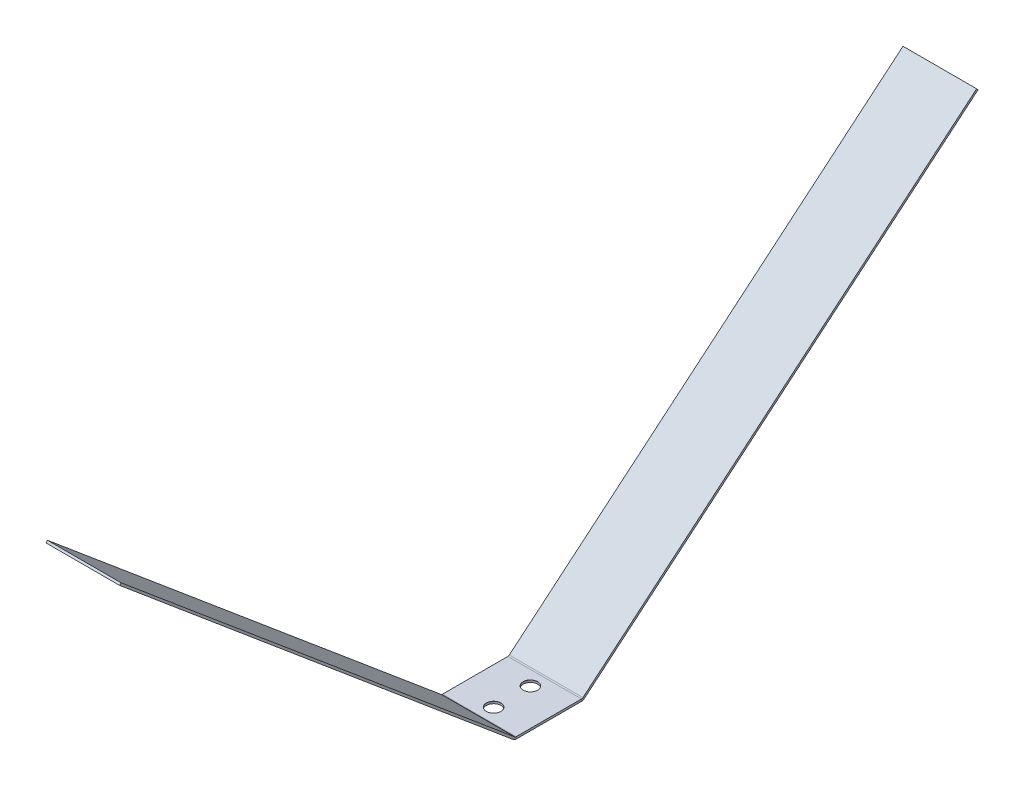
from build123d import *

# Parameters (mm, degrees)
SKETCH5_W                       = 25.4
SKETCH5_H                       = 25.4
BASE_FLANGE1_DEPTH              = 0.7366
EDGE_FLANGE1_START              = 787.4
EDGE_FLANGE1_DEPTH              = 25.4
EDGE_FLANGE1_2_DEPTH            = 25.4
F_5_0MM_DOWEL_HOLE1_D           = 5
F_5_0MM_DOWEL_HOLE1_DEPTH       = 25.4
F_5_0MM_DOWEL_HOLE1_CSINK_D     = 5.05
F_5_0MM_DOWEL_HOLE1_CSINK_ANGLE = 90
F_5_0MM_DOWEL_HOLE1_TIP         = 1.502151548


# Read off the part's stored shape, not the designer's step: Edge-Flange1
# Sheet-metal steps are written as plain solids
with BuildPart() as part:
    # Sketch5 → Base-Flange1 (new body)
    with BuildSketch(Plane(origin=(0, 0, 0), x_dir=(1, 0, 0), z_dir=(0, 1, 0))):
        with Locations((800.1, 101.6)):
            Rectangle(SKETCH5_W, SKETCH5_H)
    extrude(amount=-BASE_FLANGE1_DEPTH)

    # Edge-Flange1 outline → Edge-Flange1 (cut)
    with BuildSketch(Plane.YZ.offset(EDGE_FLANGE1_START)):
        with BuildLine():
            Line((0, -114.3), (-0.391936674, -113.832908061))
            ThreePointArc((-0.391936674, -113.832908061), (-0.647755169, -113.38981743), (-0.7366, -112.885953355))
            Line((-0.7366, -112.885953355), (-0.7366, -114.3))
            Line((-0.7366, -114.3), (0, -114.3))
        make_face()
    edge_flange1 = extrude(amount=EDGE_FLANGE1_DEPTH, mode=Mode.SUBTRACT)

    # Edge-Flange1 2 outline → Edge-Flange1 2 (add)
    with BuildSketch(Plane.YZ.offset(EDGE_FLANGE1_START)):
        with BuildLine():
            Line((0, -112.885953355), (0, -114.3))
            Line((0, -114.3), (113.551037002, -249.62485629))
            Line((113.551037002, -249.62485629), (114.115305339, -249.151378937))
            Line((114.115305339, -249.151378937), (0.172331663, -113.359430708))
            ThreePointArc((0.172331663, -113.359430708), (0.044422416, -113.137885392), (0, -112.885953355))
        make_face()
    edge_flange1_2 = extrude(amount=EDGE_FLANGE1_2_DEPTH)

    # Mirror1: Edge-Flange1, Edge-Flange1 2 across plane
    add(edge_flange1.mirror(Plane.XY.offset(-101.6)), mode=Mode.SUBTRACT)
    add(edge_flange1_2.mirror(Plane.XY.offset(-101.6)))

    # Ø5.0mm Dowel Hole1
    with Locations(Plane(origin=(0, 0, 0), x_dir=(1, 0, 0), z_dir=(0, 1, 0))):
        with Locations((800.1, 107.95), (800.1, 95.25)):
            CounterSinkHole(F_5_0MM_DOWEL_HOLE1_D / 2, F_5_0MM_DOWEL_HOLE1_CSINK_D / 2, depth=F_5_0MM_DOWEL_HOLE1_DEPTH, counter_sink_angle=F_5_0MM_DOWEL_HOLE1_CSINK_ANGLE)
            with Locations((0, 0, -(F_5_0MM_DOWEL_HOLE1_DEPTH + F_5_0MM_DOWEL_HOLE1_TIP / 2))):  # 118° drill point
                Cone(0, F_5_0MM_DOWEL_HOLE1_D / 2, F_5_0MM_DOWEL_HOLE1_TIP, mode=Mode.SUBTRACT)


solid = part.part
